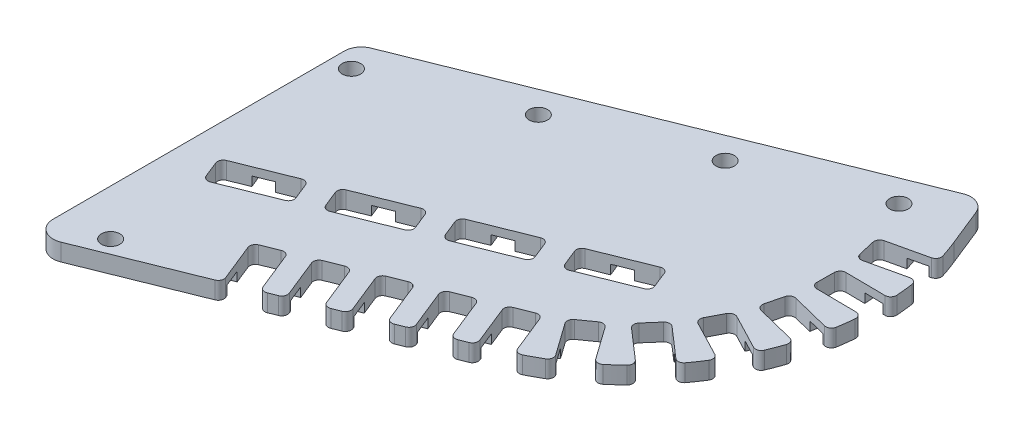
from build123d import *

# Parameters (mm, degrees)
SKETCH_1_R                       = 77.5
EXTRUDE_1_DEPTH                  = 3
SKETCH_3_R                       = 1.6
CUT_EXTRUDE_1_DEPTH              = 3
PATTERN_CIRCULAR_1_OUTLINE_R     = 1.6
PATTERN_CIRCULAR_1_DEPTH         = 3
SKETCH_4_R                       = 1.6
CUT_EXTRUDE_2_DEPTH              = 3
PATTERN_LINEAR_1_COUNT           = 3
PATTERN_LINEAR_1_PITCH           = 25
EXTRUDE_4_DEPTH                  = 3
CUT_EXTRUDE_4_DEPTH              = 11.6
FILLET_1_R                       = 1
PATTERN_CIRCULAR_2_COUNT         = 7
PATTERN_CIRCULAR_2_ANGLE         = 81
FILLET_1_OF_PATTERN_CIRCULAR_2_R = 1
PATTERN_LINEAR_2_COUNT           = 5
PATTERN_LINEAR_2_PITCH           = 8.5
FILLET_1_OF_PATTERN_LINEAR_2_R   = 1
FILLET_4_R                       = 1
CUT_EXTRUDE_5_DEPTH              = 11.6
FILLET_5_R                       = 1
CUT_EXTRUDE_6_DEPTH              = 1.6
PATTERN_LINEAR_3_COUNT           = 4
PATTERN_LINEAR_3_PITCH           = 16
FILLET_5_OF_PATTERN_LINEAR_3_R   = 1
SKETCH_17_R                      = 1.6
EXTRUDE_6_DEPTH                  = 3
FILLET_6_R                       = 2
FILLET_7_R                       = 3
FILLET_9_R                       = 10
FILLET_10_R                      = 50
FILLET_11_R                      = 2
SKETCH_18_OUTSIDE_W              = 336.845
SKETCH_18_OUTSIDE_H              = 241.424
CUT_EXTRUDE_9_DEPTH              = 10
SKETCH_19_R                      = 1.6
CUT_EXTRUDE_10_DEPTH             = 10
FILLET_12_R                      = 3
CUT_EXTRUDE_11_DEPTH             = 1.6


# Read off the part's stored shape, not the designer's step: 阵列(圆周)1
with BuildPart() as part:
    # 草图1 → 凸台-拉伸1 (new body)
    with BuildSketch(Plane(origin=(0, 0, 0), x_dir=(1, 0, 0), z_dir=(0, 1, 0))):
        with BuildLine():
            Line((-107.5, 87.5), (0, 87.5))
            ThreePointArc((0, 87.5), (87.5, 0), (0, -87.5))
            Line((0, -87.5), (-107.5, -87.5))
            Line((-107.5, -87.5), (-107.5, 87.5))
        make_face()
        with Locations(Location((0, 0, 0), (0, 0, 270))):
            Circle(SKETCH_1_R, mode=Mode.SUBTRACT)
    extrude(amount=EXTRUDE_1_DEPTH)

    # 草图3 → 切除-拉伸1 (cut)
    with BuildSketch(Plane(origin=(0, 3, 0), x_dir=(1, 0, 0), z_dir=(0, 1, 0))):
        with Locations(Location((0, 82.5, 0), (0, 0, 270))):
            Circle(SKETCH_3_R)
    extrude(amount=-CUT_EXTRUDE_1_DEPTH, mode=Mode.SUBTRACT)

    # 阵列(圆周)1 outline → 阵列(圆周)1 (cut)
    with BuildSketch(Plane(origin=(0, 0, 0), x_dir=(1, 0, 0), z_dir=(0, 1, 0))):
        with Locations((28.216661824, 77.524641215)):
            Circle(PATTERN_CIRCULAR_1_OUTLINE_R)
        with Locations((53.029977799, 63.198666557)):
            Circle(PATTERN_CIRCULAR_1_OUTLINE_R)
        with Locations((71.447095812, 41.25)):
            Circle(PATTERN_CIRCULAR_1_OUTLINE_R)
        with Locations((81.246639624, 14.325974658)):
            Circle(PATTERN_CIRCULAR_1_OUTLINE_R)
        with Locations((81.246639624, -14.325974658)):
            Circle(PATTERN_CIRCULAR_1_OUTLINE_R)
        with Locations((71.447095812, -41.25)):
            Circle(PATTERN_CIRCULAR_1_OUTLINE_R)
        with Locations((53.029977799, -63.198666557)):
            Circle(PATTERN_CIRCULAR_1_OUTLINE_R)
        with Locations((28.216661824, -77.524641215)):
            Circle(PATTERN_CIRCULAR_1_OUTLINE_R)
        with Locations((0, -82.5)):
            Circle(PATTERN_CIRCULAR_1_OUTLINE_R)
        with Locations((-28.216661824, -77.524641215)):
            Circle(PATTERN_CIRCULAR_1_OUTLINE_R)
        with Locations((-53.029977799, -63.198666557)):
            Circle(PATTERN_CIRCULAR_1_OUTLINE_R)
        with Locations((-71.447095812, -41.25)):
            Circle(PATTERN_CIRCULAR_1_OUTLINE_R)
        with Locations((-81.246639624, -14.325974658)):
            Circle(PATTERN_CIRCULAR_1_OUTLINE_R)
        with Locations((-28.216661824, 77.524641215)):
            Circle(PATTERN_CIRCULAR_1_OUTLINE_R)
    extrude(amount=PATTERN_CIRCULAR_1_DEPTH, mode=Mode.SUBTRACT)

    # 草图4 → 切除-拉伸2 (cut)
    with BuildSketch(Plane(origin=(0, 3, 0), x_dir=(1, 0, 0), z_dir=(0, 1, 0))):
        with Locations(Location((-49.817794007, 68.881691329, 0), (0, 0, 270))):
            Circle(SKETCH_4_R)
    cut_extrude_2 = extrude(amount=-CUT_EXTRUDE_2_DEPTH, mode=Mode.SUBTRACT)

    # 阵列(线性)1: 切除-拉伸2 ×3
    with Locations(*[Vector(-0.9276972686292775, 0, 0.37333333333333385) * (i * PATTERN_LINEAR_1_PITCH) for i in range(1, PATTERN_LINEAR_1_COUNT)]):
        add(cut_extrude_2, mode=Mode.SUBTRACT)

    # 草图6 → 凸台-拉伸4 (add)
    with BuildSketch(Plane(origin=(0, 3, 0), x_dir=(1, 0, 0), z_dir=(0, 1, 0))):
        with BuildLine():
            Line((-97.5, 44.303245671), (-17.609017449, 76.453784243))
            ThreePointArc((-17.609017449, 76.453784243), (-17.941394869, 43.544687501), (-41.446666667, 20.509468359))
            Line((-41.446666667, 20.509468359), (-97.5, -2.048081917))
            Line((-97.5, -2.048081917), (-97.5, 44.303245671))
        make_face()
    extrude(amount=-EXTRUDE_4_DEPTH)

    # 草图8 → 切除-拉伸4 (cut)
    with BuildSketch(Plane(origin=(0, 3, 0), x_dir=(1, 0, 0), z_dir=(0, 1, 0))):
        Polygon((-42.645909838, 16.79304322), (-47.125909838, 27.925410443), (-42.487423495, 29.79207711), (-38.007423495, 18.659709887), align=None)
    cut_extrude_4 = extrude(amount=-CUT_EXTRUDE_4_DEPTH, mode=Mode.SUBTRACT)

    # 圆角1
    fillet_1_edges = [part.edges().sort_by_distance(p)[0] for p in [
        (-47.125909838, 1.5, -27.925410443),
        (-42.487423495, 1.5, -29.79207711),
    ]]
    fillet(fillet_1_edges, radius=FILLET_1_R)

    # 阵列(圆周)2: 切除-拉伸4 ×7 about axis
    pattern_circular_2_axis = Axis((-57.5, 0, -60.40045091), (0, 1, 0))
    for i in range(1, PATTERN_CIRCULAR_2_COUNT):
        add(cut_extrude_4.rotate(pattern_circular_2_axis, i * PATTERN_CIRCULAR_2_ANGLE / (PATTERN_CIRCULAR_2_COUNT - 1)), mode=Mode.SUBTRACT)

    # 圆角1 of 阵列(圆周)2
    fillet_1_of_pattern_circular_2_edges = [part.edges().sort_by_distance(p)[0] for p in [
        (-39.831399137, 1.5, -31.244481649),
        (-35.75683922, 1.5, -34.142405299),
        (-33.513258133, 1.5, -36.174716358),
        (-30.227785472, 1.5, -39.943757269),
        (-28.520628303, 1.5, -42.443669015),
        (-26.20579864, 1.5, -46.875549387),
        (-25.129403166, 1.5, -49.704916298),
        (-23.913134357, 1.5, -54.554729716),
        (-23.526982365, 1.5, -57.557200527),
        (-23.476485617, 1.5, -62.556945528),
        (-23.801915926, 1.5, -65.566603225),
        (-24.919981699, 1.5, -70.439993105),
    ]]
    fillet(fillet_1_of_pattern_circular_2_edges, radius=FILLET_1_OF_PATTERN_CIRCULAR_2_R)

    # 阵列(线性)2: 切除-拉伸4 ×5
    with Locations(*[Vector(-0.9276972686292776, 0, 0.3733333333333338) * (i * PATTERN_LINEAR_2_PITCH) for i in range(1, PATTERN_LINEAR_2_COUNT)]):
        add(cut_extrude_4, mode=Mode.SUBTRACT)

    # 圆角1 of 阵列(线性)2
    fillet_1_of_pattern_linear_2_edges = [part.edges().sort_by_distance(p)[0] for p in [
        (-55.011336622, 1.5, -24.75207711),
        (-50.372850278, 1.5, -26.618743777),
        (-62.896763405, 1.5, -21.578743777),
        (-58.258277062, 1.5, -23.445410443),
        (-70.782190188, 1.5, -18.405410443),
        (-66.143703845, 1.5, -20.27207711),
        (-78.667616972, 1.5, -15.23207711),
        (-74.029130628, 1.5, -17.098743777),
    ]]
    fillet(fillet_1_of_pattern_linear_2_edges, radius=FILLET_1_OF_PATTERN_LINEAR_2_R)

    # 圆角4
    fillet_4_edges = [part.edges().sort_by_distance(p)[0] for p in [
        (-43.765909838, 1.5, -19.576135026),
        (-39.154578245, 1.5, -21.510278622),
        (-30.582733288, 1.5, -26.867470835),
        (-34.657293205, 1.5, -23.969547184),
        (-14.549676841, 1.5, -62.466785969),
        (-14.600173589, 1.5, -57.467040967),
        (-15.25402135, 1.5, -52.383139149),
        (-16.470290159, 1.5, -47.533325732),
        (-23.498340775, 1.5, -34.077700865),
        (-26.783813436, 1.5, -30.308659954),
        (-18.292885364, 1.5, -42.742530254),
        (-20.607715027, 1.5, -38.310649882),
        (-16.218774029, 1.5, -72.436246784),
        (-15.100708256, 1.5, -67.562856903),
        (-47.012850278, 1.5, -18.269468359),
        (-51.651336622, 1.5, -16.402801692),
        (-70.669130628, 1.5, -8.749468359),
        (-75.307616972, 1.5, -6.882801692),
        (-54.898277062, 1.5, -15.096135026),
        (-59.536763405, 1.5, -13.229468359),
        (-62.783703845, 1.5, -11.922801692),
        (-67.422190188, 1.5, -10.056135026),
    ]]
    fillet(fillet_4_edges, radius=FILLET_4_R)

    # 草图10 → 切除-拉伸5 (cut)
    with BuildSketch(Plane(origin=(0, 3, 0), x_dir=(1, 0, 0), z_dir=(0, 1, 0))):
        Polygon((-38.538550835, 47.550290215), (-49.670918059, 43.070290215), (-47.804251392, 38.431803872), (-36.671884169, 42.911803872), align=None)
    cut_extrude_5 = extrude(amount=-CUT_EXTRUDE_5_DEPTH, mode=Mode.SUBTRACT)

    # 圆角5
    fillet_5_edges = [part.edges().sort_by_distance(p)[0] for p in [
        (-47.804251392, 1.5, -38.431803872),
        (-49.670918059, 1.5, -43.070290215),
        (-38.538550835, 1.5, -47.550290215),
        (-36.671884169, 1.5, -42.911803872),
    ]]
    fillet(fillet_5_edges, radius=FILLET_5_R)

    # 草图11 → 切除-拉伸6 (cut)
    with BuildSketch(Plane(origin=(0, 0, 0), x_dir=(1, 0, 0), z_dir=(0, 1, 0))):
        with BuildLine():
            Line((-42.789050077, 37.755227367), (-46.52238341, 47.032200053))
            ThreePointArc((-46.52238341, 47.032200053), (-45.635401114, 49.113849016), (-43.553752151, 48.22686672))
            Line((-43.553752151, 48.22686672), (-39.820418817, 38.949894033))
            ThreePointArc((-39.820418817, 38.949894033), (-40.707401114, 36.86824507), (-42.789050077, 37.755227367))
        make_face()
    cut_extrude_6 = extrude(amount=CUT_EXTRUDE_6_DEPTH, mode=Mode.SUBTRACT)

    # 阵列(线性)3: 切除-拉伸5, 切除-拉伸6 ×4
    with Locations(*[Vector(-0.9276972686292776, 0, 0.37333333333333374) * (i * PATTERN_LINEAR_3_PITCH) for i in range(1, PATTERN_LINEAR_3_COUNT)]):
        add(cut_extrude_5, mode=Mode.SUBTRACT)
        add(cut_extrude_6, mode=Mode.SUBTRACT)

    # 圆角5 of 阵列(线性)3
    fillet_5_of_pattern_linear_3_edges = [part.edges().sort_by_distance(p)[0] for p in [
        (-62.64740769, 1.5, -32.458470538),
        (-64.514074357, 1.5, -37.096956881),
        (-53.381707133, 1.5, -41.576956881),
        (-51.515040467, 1.5, -36.938470538),
        (-77.490563988, 1.5, -26.485137205),
        (-79.357230655, 1.5, -31.123623548),
        (-68.224863431, 1.5, -35.603623548),
        (-66.358196765, 1.5, -30.965137205),
        (-92.333720286, 1.5, -20.511803872),
        (-94.200386953, 1.5, -25.150290215),
        (-83.06801973, 1.5, -29.630290215),
        (-81.201353063, 1.5, -24.991803872),
    ]]
    fillet(fillet_5_of_pattern_linear_3_edges, radius=FILLET_5_OF_PATTERN_LINEAR_3_R)

    # 草图17 → 凸台-拉伸6 (add)
    # profile 1 of 2: a face of its own
    with BuildSketch(Plane(origin=(0, 3, 0), x_dir=(1, 0, 0), z_dir=(0, 1, 0))):
        Polygon((-107.5, 44.051726839), (-180.536319686, 14.65971114), (-183.522986353, 22.081289289), (-107.5, 52.675229646), align=None)
        with Locations(Location((-167.186496721, 24.343833548, 0), (0, 0, 270))):
            Circle(SKETCH_17_R, mode=Mode.SUBTRACT)
        with Locations(Location((-152.343340423, 30.317166882, 0), (0, 0, 270))):
            Circle(SKETCH_17_R, mode=Mode.SUBTRACT)
    # profile 2 of 2: a face of its own
    with BuildSketch(Plane(origin=(0, 3, 0), x_dir=(1, 0, 0), z_dir=(0, 1, 0))):
        Polygon((-107.5, -18.468668511), (-107.5, -9.845165705), (-161.869653019, -31.725152291), (-158.882986353, -39.14673044), align=None)
        with Locations(Location((-130.69000709, -23.489274699, 0), (0, 0, 90))):
            Circle(SKETCH_17_R, mode=Mode.SUBTRACT)
        with Locations(Location((-145.533163388, -29.462608032, 0), (0, 0, 90))):
            Circle(SKETCH_17_R, mode=Mode.SUBTRACT)
    extrude(amount=-EXTRUDE_6_DEPTH)

    # 圆角6
    fillet_6_edges = [part.edges().sort_by_distance(p)[0] for p in [
        (-107.5, 1.5, 9.845165705),
    ]]
    fillet(fillet_6_edges, radius=FILLET_6_R)

    # 圆角7
    fillet_7_edges = [part.edges().sort_by_distance(p)[0] for p in [
        (-107.5, 1.5, -44.051726839),
    ]]
    fillet(fillet_7_edges, radius=FILLET_7_R)

    # 圆角9
    fillet_9_edges = [part.edges().sort_by_distance(p)[0] for p in [
        (-107.5, 1.5, 18.468668511),
    ]]
    fillet(fillet_9_edges, radius=FILLET_9_R)

    # 圆角10
    fillet_10_edges = [part.edges().sort_by_distance(p)[0] for p in [
        (-107.5, 1.5, -52.675229646),
    ]]
    fillet(fillet_10_edges, radius=FILLET_10_R)

    # 圆角11
    fillet_11_edges = [part.edges().sort_by_distance(p)[0] for p in [
        (-180.536319686, 1.5, -14.65971114),
        (-183.522986353, 1.5, -22.081289289),
        (-158.882986353, 1.5, 39.14673044),
        (-161.869653019, 1.5, 31.725152291),
    ]]
    fillet(fillet_11_edges, radius=FILLET_11_R)

    # 草图18 outside → 切除-拉伸9 (cut)
    with BuildSketch(Plane(origin=(0, 3, 0), x_dir=(1, 0, 0), z_dir=(0, 1, 0))):
        with Locations((-47.7105, 0)):
            Rectangle(SKETCH_18_OUTSIDE_W, SKETCH_18_OUTSIDE_H)
        with BuildLine():
            Line((-17.609017449, 76.453784243), (-21.342350782, 85.73075693))
            Line((-21.342350782, 85.73075693), (-99.5, 54.277763917))
            Line((-99.5, 54.277763917), (-99.5, -2.852942179))
            Line((-99.5, -2.852942179), (-41.446666667, 20.509468359))
            ThreePointArc((-41.446666667, 20.509468359), (-17.941394869, 43.544687501), (-17.609017449, 76.453784243))
        make_face(mode=Mode.SUBTRACT)
    extrude(amount=-CUT_EXTRUDE_9_DEPTH, mode=Mode.SUBTRACT)

    # 草图19 → 切除-拉伸10 (cut)
    with BuildSketch(Plane(origin=(0, 3, 0), x_dir=(1, 0, 0), z_dir=(0, 1, 0))):
        with Locations(Location((-91.5, 3.6, 0), (0, 0, 270))):
            Circle(SKETCH_19_R)
    extrude(amount=-CUT_EXTRUDE_10_DEPTH, mode=Mode.SUBTRACT)

    # 圆角12
    fillet_12_edges = [part.edges().sort_by_distance(p)[0] for p in [
        (-99.5, 1.5, 2.852942179),
        (-99.5, 1.5, -54.277763917),
        (-21.342350782, 1.5, -85.73075693),
    ]]
    fillet(fillet_12_edges, radius=FILLET_12_R)

    # 草图20 → 切除-拉伸11 (cut)
    with BuildSketch(Plane.XZ):
        with BuildLine():
            Line((-18.907793625, -75.931117577), (-20.774460292, -80.56960392))
            ThreePointArc((-20.774460292, -80.56960392), (-22.856109255, -81.456586216), (-23.743091551, -79.374937253))
            Line((-23.743091551, -79.374937253), (-21.876424885, -74.73645091))
            ThreePointArc((-21.876424885, -74.73645091), (-22.173245651, -45.347862191), (-43.164, -24.776875795))
            Line((-43.164, -24.776875795), (-80.271890745, -9.843542461))
            ThreePointArc((-80.271890745, -9.843542461), (-81.158873042, -7.761893498), (-79.077224079, -6.874911202))
            Line((-79.077224079, -6.874911202), (-41.969333333, -21.808244535))
            ThreePointArc((-41.969333333, -21.808244535), (-19.229349455, -44.093479798), (-18.907793625, -75.931117577))
        make_face()
    extrude(amount=-CUT_EXTRUDE_11_DEPTH, mode=Mode.SUBTRACT)


solid = part.part
